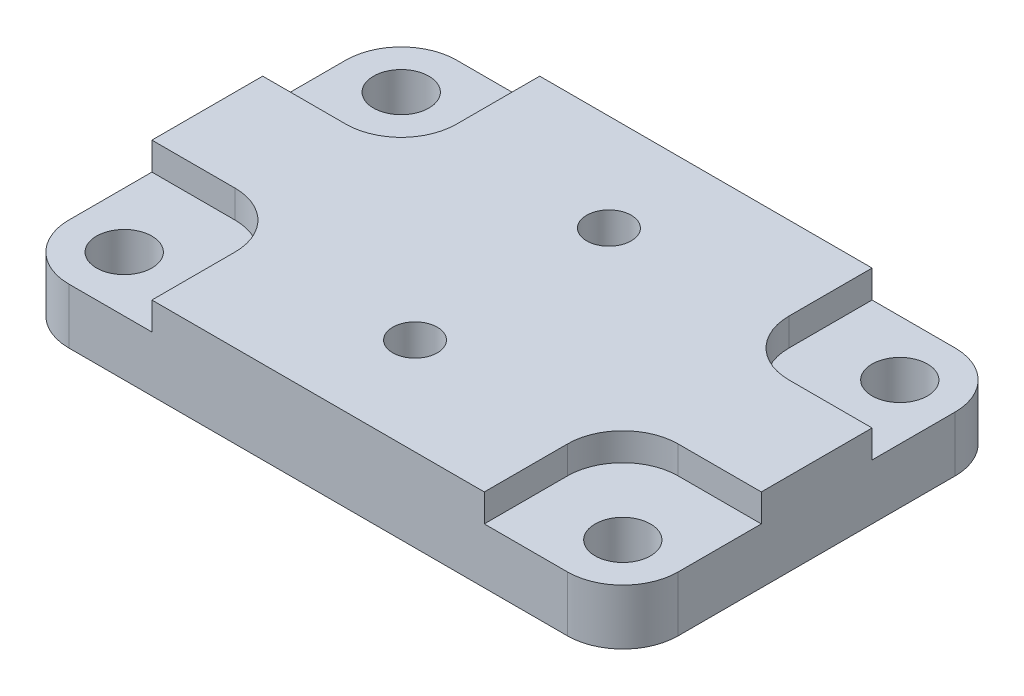
from build123d import *

# Parameters (mm, degrees)
SKETCH1_W                                          = 69.85
SKETCH1_H                                          = 44.45
BOSS_EXTRUDE1_DEPTH                                = 9.525
CSK_FOR_10_FLAT_HEAD_MACHINE_SCREW_100_D           = 5.1054
CSK_FOR_10_FLAT_HEAD_MACHINE_SCREW_100_CSINK_D     = 9.779
CSK_FOR_10_FLAT_HEAD_MACHINE_SCREW_100_CSINK_ANGLE = 82
FILLET4_R                                          = 6.35
F_1_4_0_25_DIAMETER_HOLE1_D                        = 6.35
SKETCH10_W                                         = 15.875
SKETCH10_H                                         = 15.875
CUT_EXTRUDE2_DEPTH                                 = 3.175
FILLET5_R                                          = 6.35
FILLET5_OF_MIRROR2_R                               = 6.35
MIRROR3_START                                      = 6.35
MIRROR3_OUTLINE_R                                  = 3.175
MIRROR3_DEPTH                                      = 3.175


# Read off the part's stored shape, not the designer's step: Mirror3
with BuildPart() as part:
    # Sketch1 → Boss-Extrude1 (new body)
    with BuildSketch(Plane(origin=(0, 0, 0), x_dir=(1, 0, 0), z_dir=(0, 1, 0))):
        Rectangle(SKETCH1_W, SKETCH1_H)
    extrude(amount=BOSS_EXTRUDE1_DEPTH)

    # CSK for #10 Flat Head Machine Screw (100)1 (through all)
    with Locations(Plane(origin=(0, 0, 0), x_dir=(-1, 0, 0), z_dir=(0, -1, 0))):
        with Locations((0, 11.1125), (0, -11.1125)):
            CounterSinkHole(CSK_FOR_10_FLAT_HEAD_MACHINE_SCREW_100_D / 2, CSK_FOR_10_FLAT_HEAD_MACHINE_SCREW_100_CSINK_D / 2, counter_sink_angle=CSK_FOR_10_FLAT_HEAD_MACHINE_SCREW_100_CSINK_ANGLE)

    # Fillet4
    fillet4_edges = [part.edges().sort_by_distance(p)[0] for p in [
        (34.925, 4.7625, 22.225),
        (-34.925, 4.7625, 22.225),
        (-34.925, 4.7625, -22.225),
        (34.925, 4.7625, -22.225),
    ]]
    fillet(fillet4_edges, radius=FILLET4_R)

    # 1/4 (0.25) Diameter Hole1 (through all)
    with Locations(Plane(origin=(0, 0, 0), x_dir=(-1, 0, 0), z_dir=(0, -1, 0))):
        with Locations((-28.575, 15.875), (-28.575, -15.875)):
            f_1_4_0_25_diameter_hole1 = Hole(F_1_4_0_25_DIAMETER_HOLE1_D / 2)

    # Mirror1: 1/4 (0.25) Diameter Hole1 across plane
    add(f_1_4_0_25_diameter_hole1.mirror(Plane(origin=(0, 0, 0), x_dir=(0, 0, 1), z_dir=(1, 0, 0))), mode=Mode.SUBTRACT)

    # Sketch10 → Cut-Extrude2 (cut)
    with BuildSketch(Plane(origin=(0, 9.525, 0), x_dir=(1, 0, 0), z_dir=(0, 1, 0))):
        with Locations((-26.9875, 14.2875)):
            Rectangle(SKETCH10_W, SKETCH10_H)
    cut_extrude2 = extrude(amount=-CUT_EXTRUDE2_DEPTH, mode=Mode.SUBTRACT)

    # Fillet5
    fillet5_edges = [part.edges().sort_by_distance(p)[0] for p in [
        (-19.05, 7.9375, -6.35),
    ]]
    fillet(fillet5_edges, radius=FILLET5_R)

    # Mirror2: Cut-Extrude2 across plane
    add(cut_extrude2.mirror(Plane.XY), mode=Mode.SUBTRACT)

    # Fillet5 of Mirror2
    fillet5_of_mirror2_edges = [part.edges().sort_by_distance(p)[0] for p in [
        (-19.05, 7.9375, 6.35),
    ]]
    fillet(fillet5_of_mirror2_edges, radius=FILLET5_OF_MIRROR2_R)

    # Mirror3 outline → Mirror3 (cut)
    # profile 1 of 2: a face of its own
    with BuildSketch(Plane(origin=(0, 0, 0), x_dir=(1, 0, 0), z_dir=(0, 1, 0)).offset(MIRROR3_START)):
        with BuildLine():
            Line((25.4, 6.35), (34.925, 6.35))
            Line((34.925, 6.35), (34.925, 15.875))
            ThreePointArc((34.925, 15.875), (33.065128061, 20.365128061), (28.575, 22.225))
            Line((28.575, 22.225), (19.05, 22.225))
            Line((19.05, 22.225), (19.05, 12.7))
            ThreePointArc((19.05, 12.7), (20.909871939, 8.209871939), (25.4, 6.35))
        make_face()
        with Locations((28.575, 15.875)):
            Circle(MIRROR3_OUTLINE_R, mode=Mode.SUBTRACT)
    # profile 2 of 2: a face of its own
    with BuildSketch(Plane(origin=(0, 0, 0), x_dir=(1, 0, 0), z_dir=(0, 1, 0)).offset(MIRROR3_START)):
        with BuildLine():
            Line((34.925, -15.875), (34.925, -6.35))
            Line((34.925, -6.35), (25.4, -6.35))
            ThreePointArc((25.4, -6.35), (20.909871939, -8.209871939), (19.05, -12.7))
            Line((19.05, -12.7), (19.05, -22.225))
            Line((19.05, -22.225), (28.575, -22.225))
            ThreePointArc((28.575, -22.225), (33.065128061, -20.365128061), (34.925, -15.875))
        make_face()
        with Locations((28.575, -15.875)):
            Circle(MIRROR3_OUTLINE_R, mode=Mode.SUBTRACT)
    extrude(amount=MIRROR3_DEPTH, mode=Mode.SUBTRACT)


solid = part.part
